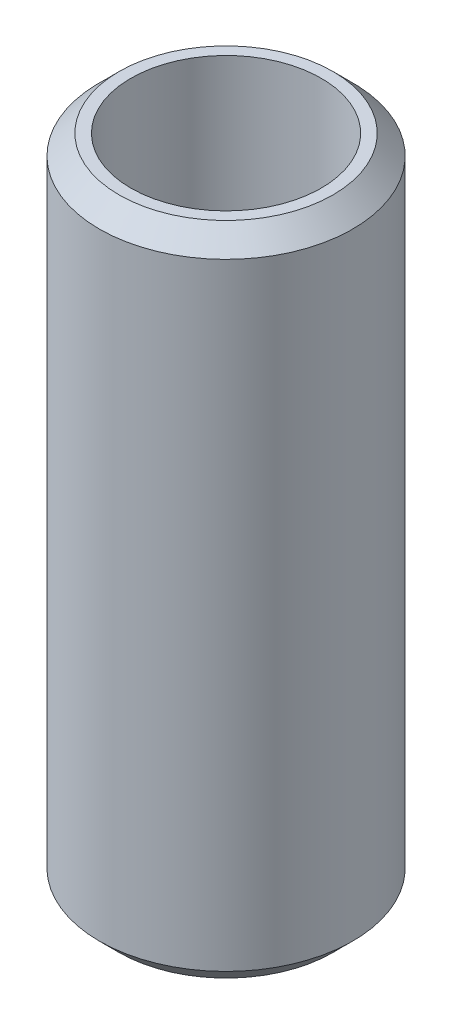
from build123d import *

# Parameters (mm, degrees)
SKETCH1_R           = 37.5
BOSS_EXTRUDE1_DEPTH = 194.250427747
SKETCH2_R           = 28.18712921
CUT_EXTRUDE1_DEPTH  = 202.359699741
CHAMFER1_SIZE       = 5.839802443


with BuildPart() as part:
    # Sketch1 → Boss-Extrude1 (new body)
    with BuildSketch(Plane(origin=(0, 0, 0), x_dir=(1, 0, 0), z_dir=(0, 1, 0))):
        Circle(SKETCH1_R)
    extrude(amount=BOSS_EXTRUDE1_DEPTH)

    # Sketch2 → Cut-Extrude1 (cut, through all)
    with BuildSketch(Plane(origin=(0, 0, 0), x_dir=(1, 0, 0), z_dir=(0, 1, 0))):
        Circle(SKETCH2_R)
    extrude(amount=CUT_EXTRUDE1_DEPTH, mode=Mode.SUBTRACT)

    # Chamfer1
    chamfer1_edges = [part.edges().sort_by_distance(p)[0] for p in [
        (-37.5, 194.250427747, 0),
        (-37.5, 0, 0),
    ]]
    chamfer(chamfer1_edges, length=CHAMFER1_SIZE)


solid = part.part
